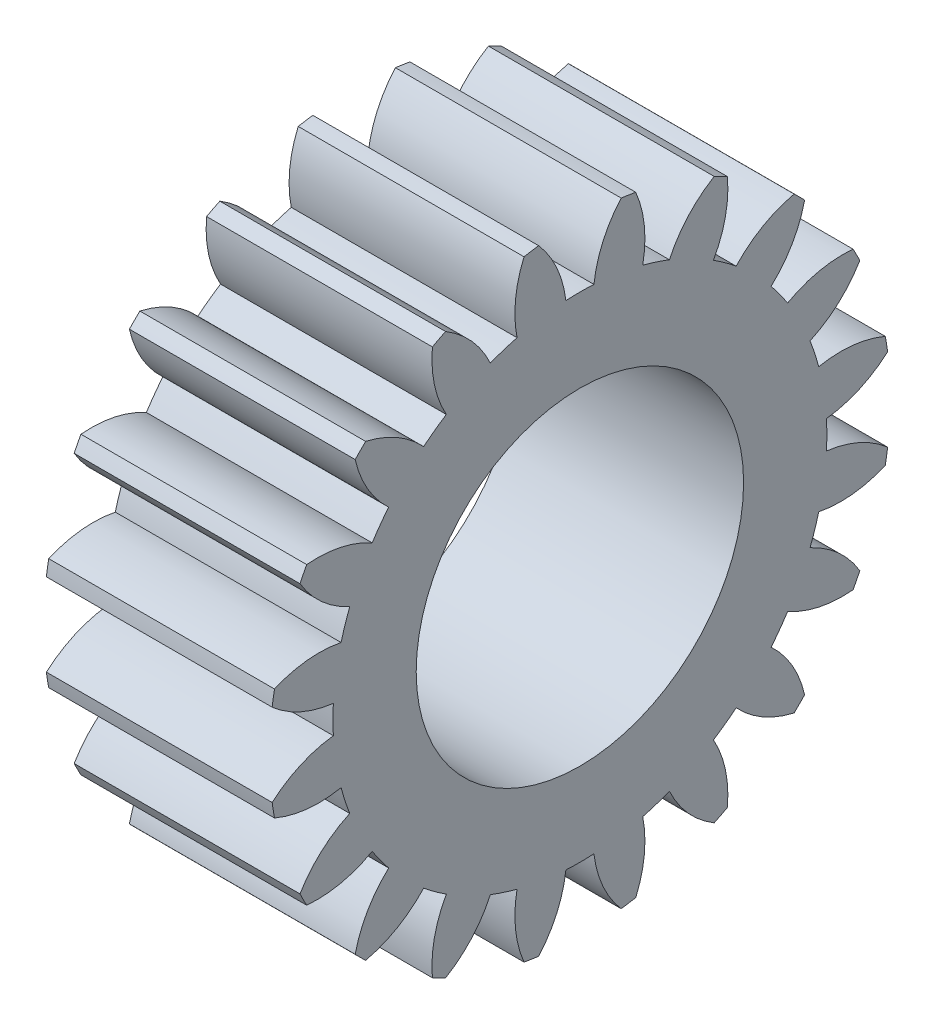
from build123d import *

# Parameters (mm, degrees)
BASPROSKE_W        = 10
BASPROSKE_H        = 13.75
TOOTHCUT_DEPTH     = 22.866069606
TEETHCUTS_COUNT    = 20
TEETHCUTS_ANGLE    = 342
BORSKE_R           = 7
BORE_DEPTH         = 50.0000508
SKETCH2_R          = 7.25
CUT_EXTRUDE1_DEPTH = 10


with BuildPart() as part:
    # BasProSke → Base-Revolve (revolve)
    with BuildSketch(Plane(origin=(0, 0, 0), x_dir=(1, 0, 0), z_dir=(0, 1, 0))):
        with Locations((5, 6.875)):
            Rectangle(BASPROSKE_W, BASPROSKE_H)
    revolve(axis=Axis((-10, 0, 0), (1, 0, 0)))

    # TooCutSke → ToothCut (cut, through all)
    with BuildSketch(Plane(origin=(0, 0, 0), x_dir=(0, 0, -1), z_dir=(1, 0, 0))):
        with BuildLine():
            ThreePointArc((0.62110296, 10.918848994), (0, 10.9365), (-0.62110296, 10.918848994))
            ThreePointArc((-0.62110296, 10.918848994), (-1.024517052, 12.378857135), (-1.846615859, 13.651067908))
            ThreePointArc((-1.846615859, 13.651067908), (0, 13.7754), (1.846615859, 13.651067908))
            ThreePointArc((1.846615859, 13.651067908), (1.024517052, 12.378857135), (0.62110296, 10.918848994))
        make_face()
    toothcut = extrude(amount=TOOTHCUT_DEPTH, mode=Mode.SUBTRACT)

    # TeethCuts: ToothCut ×20 about axis
    teethcuts_axis = Axis((-10, 0, 0), (1, 0, 0))
    for i in range(1, TEETHCUTS_COUNT):
        add(toothcut.rotate(teethcuts_axis, i * TEETHCUTS_ANGLE / (TEETHCUTS_COUNT - 1)), mode=Mode.SUBTRACT)

    # BorSke → Bore (cut, symmetric)
    with BuildSketch(Plane(origin=(0, 0, 0), x_dir=(0, 0, -1), z_dir=(1, 0, 0))):
        Circle(BORSKE_R)
    extrude(amount=BORE_DEPTH, both=True, mode=Mode.SUBTRACT)

    # Sketch2 → Cut-Extrude1 (cut)
    with BuildSketch(Plane(origin=(10, 0, 0), x_dir=(0, 0, -1), z_dir=(1, 0, 0))):
        Circle(SKETCH2_R)
    extrude(amount=-CUT_EXTRUDE1_DEPTH, mode=Mode.SUBTRACT)


solid = part.part
